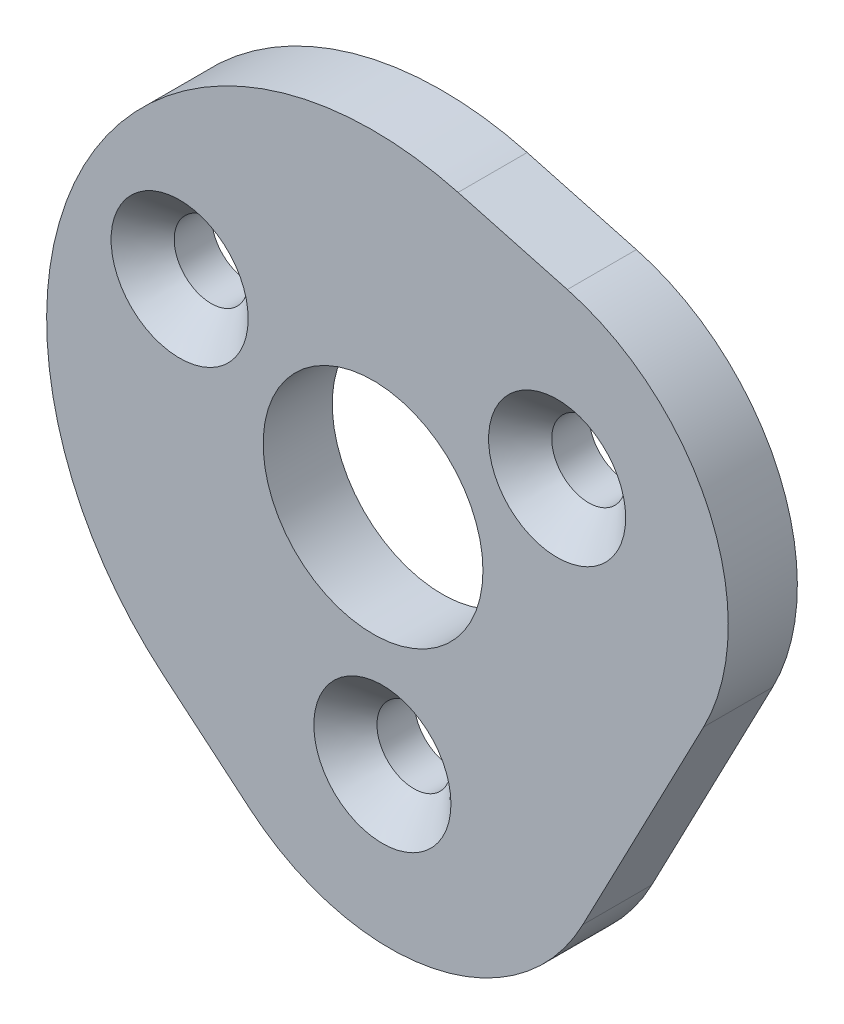
from build123d import *

# Parameters (mm, degrees)
SKETCH1_R                                       = 5.05
BOSS_EXTRUDE1_DEPTH                             = 3.175
FILLET1_R                                       = 10
CSK_FOR_M3_FLAT_HEAD_MACHINE_SCREW1_D           = 3.4
CSK_FOR_M3_FLAT_HEAD_MACHINE_SCREW1_CSINK_D     = 6.3
CSK_FOR_M3_FLAT_HEAD_MACHINE_SCREW1_CSINK_ANGLE = 90
CIRPATTERN1_COUNT                               = 3


with BuildPart() as part:
    # Sketch1 → Boss-Extrude1 (new body)
    with BuildSketch(Plane.XY):
        with BuildLine():
            ThreePointArc((-93.868600914, 23.98240471), (-111.074393046, 16.437300959), (-107.416814145, -1.990666647))
            Line((-107.416814145, -1.990666647), (-103.145564739, -5.574670449))
            Line((-103.145564739, -5.574670449), (-93.896438768, -13.335608639))
            Line((-93.896438768, -13.335608639), (-76.828027546, 19.385980182))
            Line((-76.828027546, 19.385980182), (-91.668393588, 23.388933663))
            Line((-91.668393588, 23.388933663), (-93.868600914, 23.98240471))
        make_face()
        with Locations((-97.775, 9.5)):
            Circle(SKETCH1_R, mode=Mode.SUBTRACT)
    extrude(amount=BOSS_EXTRUDE1_DEPTH)

    # Fillet1
    fillet1_edges = [part.edges().sort_by_distance(p)[0] for p in [
        (-93.896438768, -13.335608639, 1.5875),
        (-76.828027546, 19.385980182, 1.5875),
    ]]
    fillet(fillet1_edges, radius=FILLET1_R)

    # CSK for M3 Flat Head Machine Screw1 (through all)
    with Locations(Plane.XY.offset(3.175)):
        with Locations((-106.663427686, 14.136429475)):
            csk_for_m3_flat_head_machine_screw1 = CounterSinkHole(CSK_FOR_M3_FLAT_HEAD_MACHINE_SCREW1_D / 2, CSK_FOR_M3_FLAT_HEAD_MACHINE_SCREW1_CSINK_D / 2, counter_sink_angle=CSK_FOR_M3_FLAT_HEAD_MACHINE_SCREW1_CSINK_ANGLE)

    # CirPattern1: CSK for M3 Flat Head Machine Screw1 ×3 about axis
    cirpattern1_axis = Axis((-97.775, 9.5, 3.175), (0, 0, -1))
    for i in range(1, CIRPATTERN1_COUNT):
        add(csk_for_m3_flat_head_machine_screw1.rotate(cirpattern1_axis, i * 360 / CIRPATTERN1_COUNT), mode=Mode.SUBTRACT)


solid = part.part
